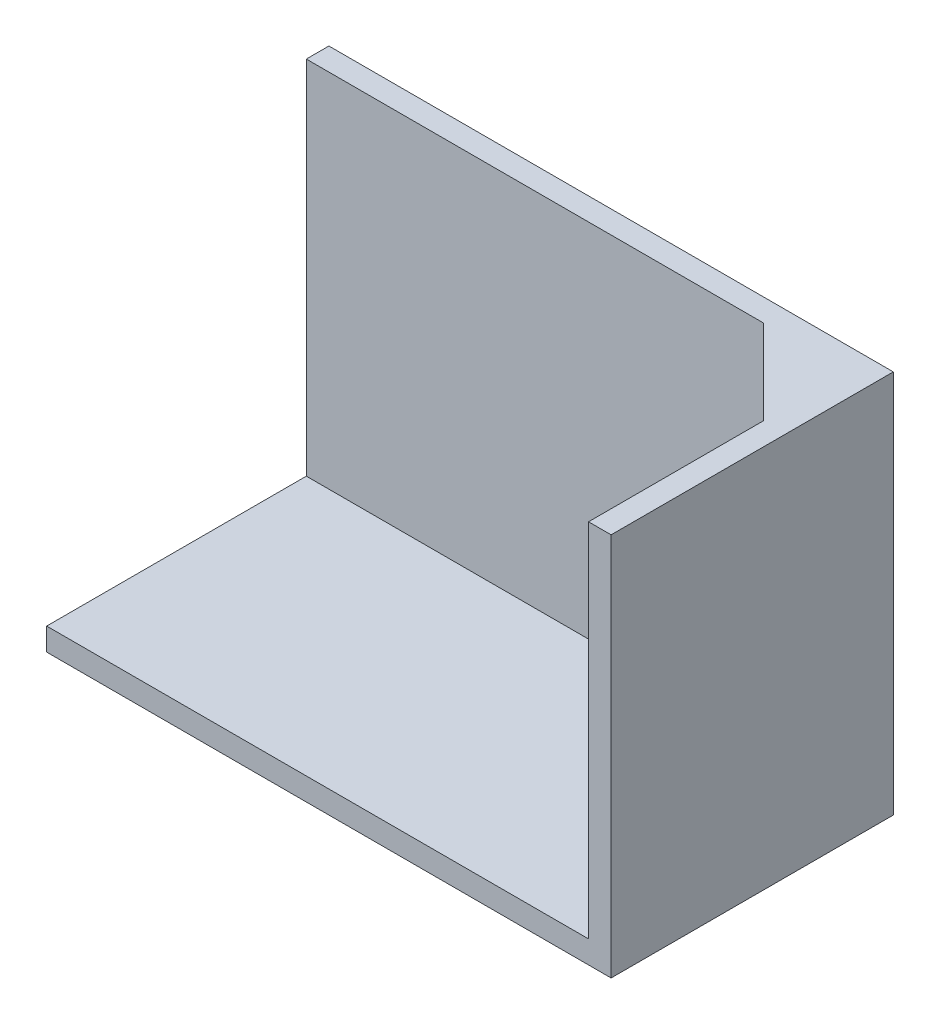
from build123d import *

# Parameters (mm, degrees)
BOSS_EXTRUDE1_DEPTH       = 64
SKETCH2_W                 = 100
SKETCH2_H                 = 50
BOSS_EXTRUDE2_DEPTH       = 4
BOSS_EXTRUDE3_DEPTH       = 4
SKETCH4_W                 = 25
SKETCH4_H                 = 35
BOSS_EXTRUDE4_DEPTH       = 4
CHAMFER1_SIZE             = 10
CHAMFER2_SIZE             = 2
F_6_0MM_START             = -4
F_6_0MM_DOWEL_SLOT1_DEPTH = 4
FILLET1_R                 = 4


# Read off the part's stored shape, not the designer's step: Ø6.0mm Dowel Slot1
with BuildPart() as part:
    # Sketch1 → Boss-Extrude1 (new body)
    with BuildSketch(Plane(origin=(0, 0, 0), x_dir=(1, 0, 0), z_dir=(0, 1, 0))):
        Polygon((0, 0), (100, 0), (100, -50), (96, -50), (96, -4), (0, -4), align=None)
    extrude(amount=BOSS_EXTRUDE1_DEPTH)

    # Sketch2 → Boss-Extrude2 (add)
    with BuildSketch(Plane.XZ):
        with Locations((50, 25)):
            Rectangle(SKETCH2_W, SKETCH2_H)
    extrude(amount=BOSS_EXTRUDE2_DEPTH)

    # Sketch3 → Boss-Extrude3 (add)
    with BuildSketch(Plane(origin=(0, 64, 0), x_dir=(1, 0, 0), z_dir=(0, 1, 0))):
        Polygon((96, -4), (81, -4), (96, -19), align=None)
    extrude(amount=-BOSS_EXTRUDE3_DEPTH)

    # Sketch4 → Boss-Extrude4 (add)
    with BuildSketch(Plane.XZ.offset(4)):
        with Locations((40, -17.5)):
            Rectangle(SKETCH4_W, SKETCH4_H)
    extrude(amount=-BOSS_EXTRUDE4_DEPTH)

    # Chamfer1
    chamfer1_edges = [part.edges().sort_by_distance(p)[0] for p in [
        (52.5, -2, 0),
        (27.5, -2, 0),
    ]]
    chamfer(chamfer1_edges, length=CHAMFER1_SIZE)

    # Chamfer2
    chamfer2_edges = [part.edges().sort_by_distance(p)[0] for p in [
        (52.5, -2, -35),
        (27.5, -2, -35),
    ]]
    chamfer(chamfer2_edges, length=CHAMFER2_SIZE)

    # Ø6.0mm Dowel Slot1 outline → Ø6.0mm Dowel Slot1 (cut)
    with BuildSketch(Plane(origin=(0, 0, 0), x_dir=(1, 0, 0), z_dir=(0, 1, 0)).offset(F_6_0MM_START)):
        with BuildLine():
            Line((34.75, 6.75), (45.25, 6.75))
            ThreePointArc((45.25, 6.75), (48.5, 10), (45.25, 13.25))
            Line((45.25, 13.25), (34.75, 13.25))
            ThreePointArc((34.75, 13.25), (31.5, 10), (34.75, 6.75))
        make_face()
        with BuildLine():
            Line((34.75, 21.75), (45.25, 21.75))
            ThreePointArc((45.25, 21.75), (48.5, 25), (45.25, 28.25))
            Line((45.25, 28.25), (34.75, 28.25))
            ThreePointArc((34.75, 28.25), (31.5, 25), (34.75, 21.75))
        make_face()
    extrude(amount=F_6_0MM_DOWEL_SLOT1_DEPTH, mode=Mode.SUBTRACT)

    # Fillet1
    fillet1_edges = [part.edges().sort_by_distance(p)[0] for p in [
        (40, 0, 0),
    ]]
    fillet(fillet1_edges, radius=FILLET1_R)


solid = part.part
